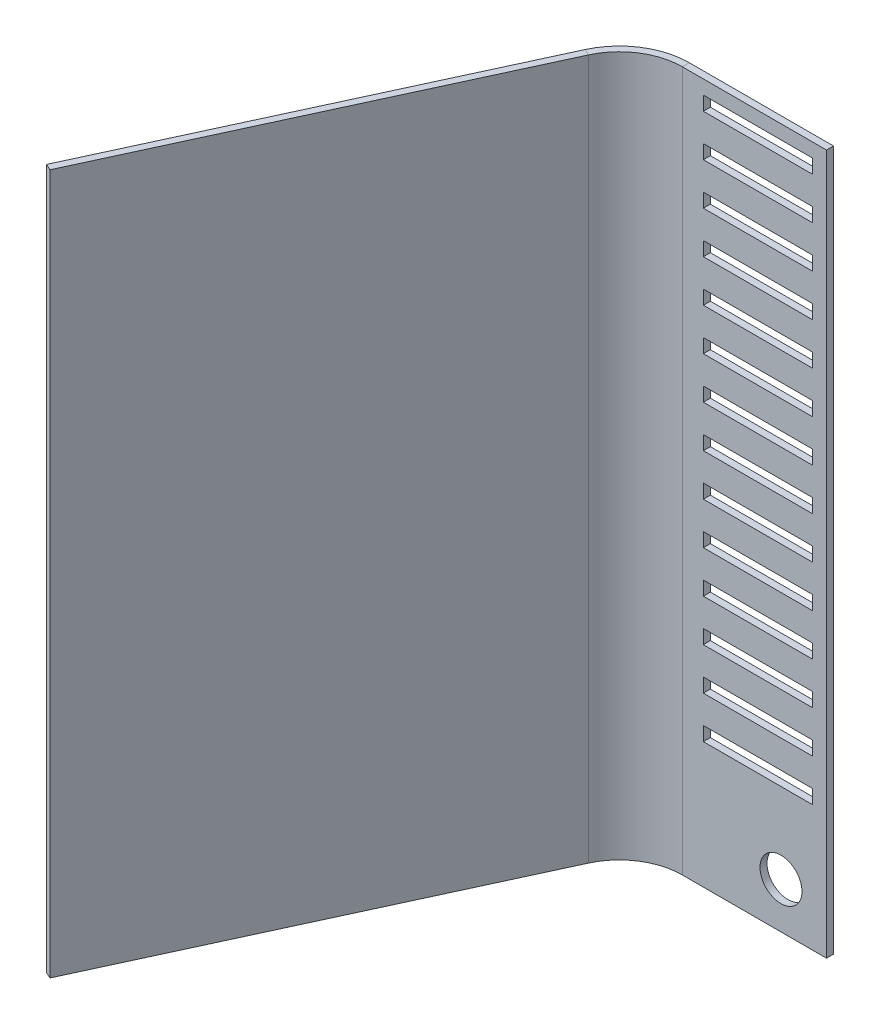
from build123d import *

# Parameters (mm, degrees)
BASE_FLANGE1_DEPTH = 1000
SKETCH9_W          = 155.95
SKETCH9_H          = 20
CUT_EXTRUDE1_DEPTH = 100
LPATTERN1_COUNT    = 14
LPATTERN1_PITCH    = 60
SKETCH10_R         = 30
CUT_EXTRUDE2_DEPTH = 100


# Sheet-metal steps are written as plain solids
with BuildPart() as part:
    # Sketch4 → Base-Flange1 (new body)
    with BuildSketch(Plane(origin=(0, 0, 0), x_dir=(1, 0, 0), z_dir=(0, 1, 0))):
        with BuildLine():
            Line((-515.583926996, -462.787511714), (-273.037104037, 64.062598538))
            ThreePointArc((-273.037104037, 64.062598538), (-236.13675777, 106.451786664), (-182.200878132, 122.244180787))
            Line((-182.200878132, 122.244180787), (23.749121868, 122.244180787))
            Line((23.749121868, 122.244180787), (23.749121868, 112.244180787))
            Line((23.749121868, 112.244180787), (-182.200878132, 112.244180787))
            ThreePointArc((-182.200878132, 112.244180787), (-230.743169807, 98.031026076), (-263.953481446, 59.880756763))
            Line((-263.953481446, 59.880756763), (-506.500304406, -466.969353489))
            Line((-506.500304406, -466.969353489), (-515.583926996, -462.787511714))
        make_face()
    extrude(amount=BASE_FLANGE1_DEPTH)

    # Sketch9 → Cut-Extrude1 (cut)
    with BuildSketch(Plane(origin=(0, 0, -122.244180787), x_dir=(-1, 0, 0), z_dir=(0, 0, -1))):
        with Locations((74.225878132, 970)):
            Rectangle(SKETCH9_W, SKETCH9_H)
    cut_extrude1 = extrude(amount=-CUT_EXTRUDE1_DEPTH, mode=Mode.SUBTRACT)

    # LPattern1: Cut-Extrude1 ×14
    with Locations(*[(0, -i * LPATTERN1_PITCH, 0) for i in range(1, LPATTERN1_COUNT)]):
        add(cut_extrude1, mode=Mode.SUBTRACT)

    # Sketch10 → Cut-Extrude2 (cut)
    with BuildSketch(Plane(origin=(0, 0, -122.244180787), x_dir=(-1, 0, 0), z_dir=(0, 0, -1))):
        with Locations((41.250878132, 65)):
            Circle(SKETCH10_R)
    extrude(amount=-CUT_EXTRUDE2_DEPTH, mode=Mode.SUBTRACT)


solid = part.part
